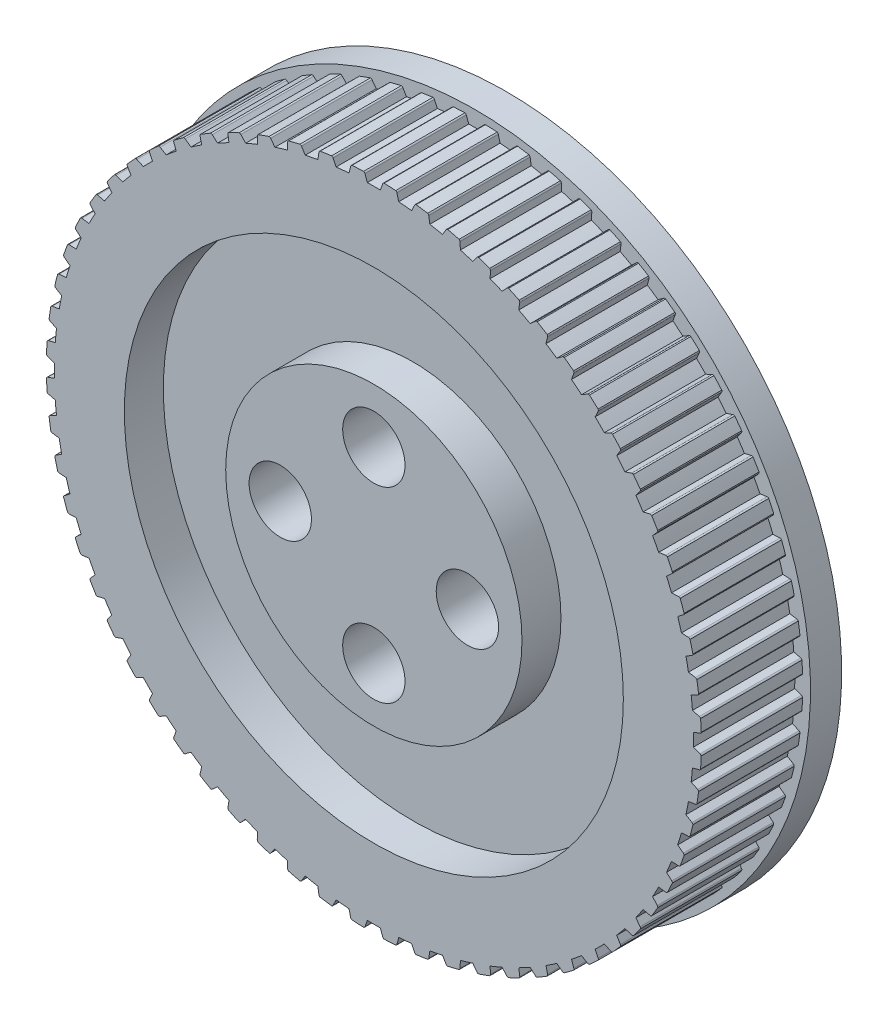
from build123d import *

# Parameters (mm, degrees)
ESQUISSE1_R                  = 21
BOSS_EXTRU_1_DEPTH           = 6.5
ENL_V_MAT_EXTRU_1_REACH      = 32.401
R_P_TITION_CIRCULAIRE1_COUNT = 64
ESQUISSE4_R                  = 21.5
BOSS_EXTRU_3_DEPTH           = 2
ESQUISSE6_R                  = 16
ENL_V_MAT_EXTRU_3_DEPTH      = 2.5
ESQUISSE7_R                  = 2
ENL_V_MAT_EXTRU_4_DEPTH      = 31.991934435
ENL_V_START                  = -2.5
ESQUISSE8_R                  = 16
ESQUISSE8_R_2                = 9.5
ENL_V_MAT_EXTRU_5_DEPTH      = 2.5


with BuildPart() as part:
    # Esquisse1 → Boss.-Extru.1 (new body)
    with BuildSketch(Plane.XY):
        Circle(ESQUISSE1_R)
    extrude(amount=BOSS_EXTRU_1_DEPTH)

    # Esquisse2 → Enlèv. mat.-Extru.1 (cut, up to next)
    with BuildSketch(Plane.XY.offset(6.5), mode=Mode.PRIVATE) as enl_v_mat_extru_1_sk1:
        with BuildLine():
            Line((-0.415, 20.487498661), (-0.570652096, 20.91514928))
            ThreePointArc((-0.570652096, 20.91514928), (-0.618101473, 20.974017052), (-0.691655993, 20.99152678))
            Line((-0.691655993, 20.99152678), (-1.016, 20.975408077))
            Line((-1.016, 20.975408077), (-1.016, 21.394998837))
            Line((-1.016, 21.394998837), (1.016, 21.394998837))
            Line((1.016, 21.394998837), (1.016, 20.975408077))
            Line((1.016, 20.975408077), (0.691655993, 20.99152678))
            ThreePointArc((0.691655993, 20.99152678), (0.618101473, 20.974017052), (0.570652096, 20.91514928))
            Line((0.570652096, 20.91514928), (0.415, 20.487498661))
            ThreePointArc((0.415, 20.487498661), (0, 20.491701403), (-0.415, 20.487498661))
        make_face()
    enl_v_mat_extru_1_tool1 = extrude(enl_v_mat_extru_1_sk1.sketch, amount=-ENL_V_MAT_EXTRU_1_REACH, mode=Mode.PRIVATE) & part.part
    enl_v_mat_extru_1 = enl_v_mat_extru_1_tool1.solids().sort_by_distance((0, 21.02561, 6.5))[0]
    add(enl_v_mat_extru_1, mode=Mode.SUBTRACT)

    # Répétition circulaire1: Enlèv. mat.-Extru.1 ×64 about axis
    r_p_tition_circulaire1_axis = Axis((0, 0, 6.5), (0, 0, 1))
    for i in range(1, R_P_TITION_CIRCULAIRE1_COUNT):
        add(enl_v_mat_extru_1.rotate(r_p_tition_circulaire1_axis, i * 360 / R_P_TITION_CIRCULAIRE1_COUNT), mode=Mode.SUBTRACT)

    # Esquisse4 → Boss.-Extru.3 (add)
    with BuildSketch(Plane(origin=(0, 0, 0), x_dir=(-1, 0, 0), z_dir=(0, 0, -1))):
        Circle(ESQUISSE4_R)
    extrude(amount=BOSS_EXTRU_3_DEPTH)

    # Esquisse6 → Enlèv. mat.-Extru.3 (cut)
    with BuildSketch(Plane(origin=(0, 0, -2), x_dir=(-1, 0, 0), z_dir=(0, 0, -1))):
        Circle(ESQUISSE6_R)
    extrude(amount=-ENL_V_MAT_EXTRU_3_DEPTH, mode=Mode.SUBTRACT)

    # Esquisse7 → Enlèv. mat.-Extru.4 (cut, through all)
    with BuildSketch(Plane(origin=(0, 0, 0.5), x_dir=(-1, 0, 0), z_dir=(0, 0, -1))):
        with Locations((6, 0)):
            Circle(ESQUISSE7_R)
        with Locations((0, -6)):
            Circle(ESQUISSE7_R)
        with Locations((-6, 0)):
            Circle(ESQUISSE7_R)
        with Locations((0, 6)):
            Circle(ESQUISSE7_R)
    extrude(amount=-ENL_V_MAT_EXTRU_4_DEPTH, mode=Mode.SUBTRACT)

    # Esquisse8 → Enlèv. mat.-Extru.5 (cut)
    with BuildSketch(Plane.XY.offset(6.5).offset(ENL_V_START)):
        Circle(ESQUISSE8_R)
        Circle(ESQUISSE8_R_2, mode=Mode.SUBTRACT)
    extrude(amount=ENL_V_MAT_EXTRU_5_DEPTH, mode=Mode.SUBTRACT)


solid = part.part
